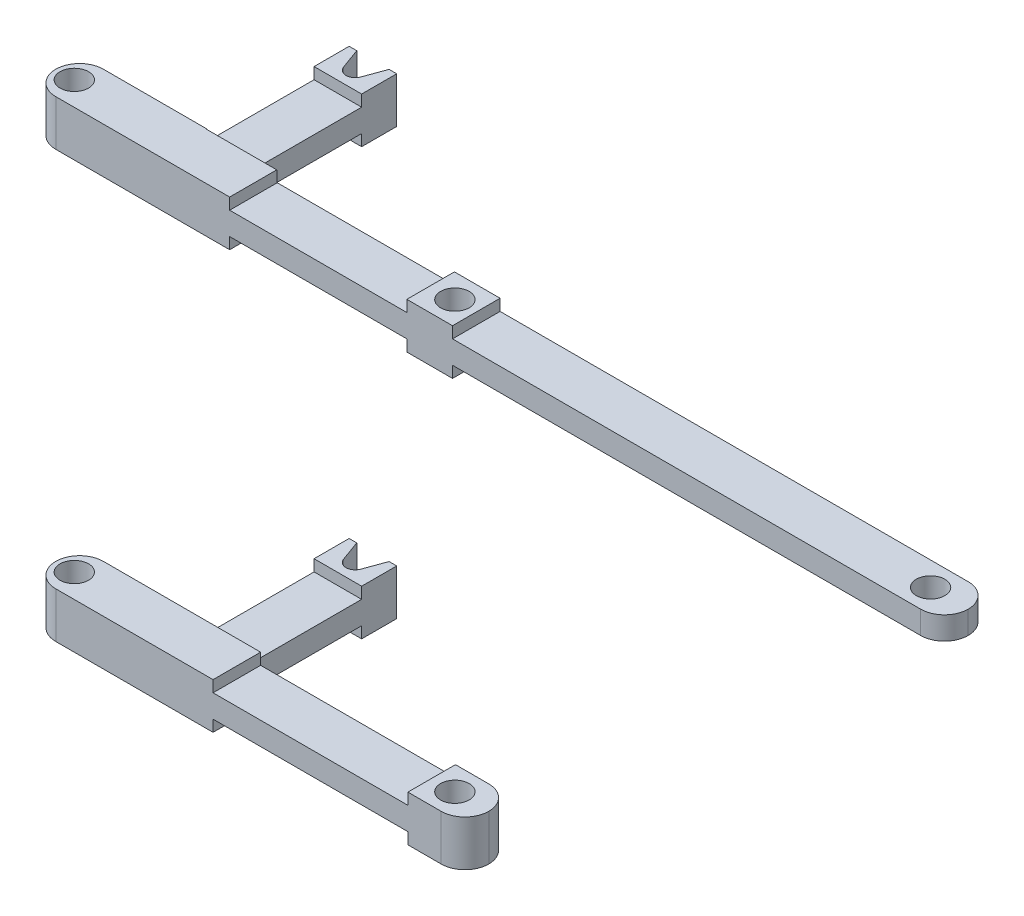
from build123d import *

# Parameters (mm, degrees)
SKETCH1_R                = 7.5
BOSS_EXTRUDE1_DEPTH      = 24
SKETCH7_R                = 7.5
BOSS_EXTRUDE2_DEPTH      = 24
SKETCH9_W                = 267.304996702
SKETCH9_H                = 6
SKETCH9_W_2              = 93.120375714
CUT_EXTRUDE2_DEPTH       = 25
SKETCH10_W               = 102.39026263
SKETCH10_H               = 6
CUT_EXTRUDE6_DEPTH       = 40
CUT_EXTRUDE7_START       = -37.208675348
CUT_EXTRUDE7_OUTLINE_W   = 56.567816269
CUT_EXTRUDE7_OUTLINE_H   = 6
CUT_EXTRUDE7_OUTLINE_W_2 = 56.815074254
CUT_EXTRUDE7_DEPTH       = 37.208675348
FILLET1_R                = 12.5
FILLET2_R                = 12.5


# Read off the part's stored shape, not the designer's step: Cut-Extrude7
with BuildPart() as part:
    # Sketch1 → Boss-Extrude1 (new body)
    with BuildSketch(Plane(origin=(0, 0, 0), x_dir=(1, 0, 0), z_dir=(0, 1, 0))):
        with BuildLine():
            Line((-206.314451257, 94.69754914), (-210.303240713, 105.656658099))
            Line((-210.303240713, 105.656658099), (-214.303240713, 105.656658099))
            Line((-214.303240713, 105.656658099), (-214.303240713, 30.656658099))
            Line((-214.303240713, 30.656658099), (-280.969907379, 30.656658099))
            Line((-280.969907379, 30.656658099), (-280.969907379, 5.656658099))
            Line((-280.969907379, 5.656658099), (198.538356926, 5.656658099))
            Line((198.538356926, 5.656658099), (198.538356926, 30.656658099))
            Line((198.538356926, 30.656658099), (-189.303240713, 30.656658099))
            Line((-189.303240713, 30.656658099), (-189.303240713, 105.656658099))
            Line((-189.303240713, 105.656658099), (-193.303240713, 105.656658099))
            Line((-193.303240713, 105.656658099), (-197.292030168, 94.69754914))
            ThreePointArc((-197.292030168, 94.69754914), (-201.803240713, 91.53876551), (-206.314451257, 94.69754914))
        make_face()
        with Locations(Location((-271.236698838, 18.156658099, 0), (0, 0, 270))):
            Circle(SKETCH1_R, mode=Mode.SUBTRACT)
        with BuildLine():
            ThreePointArc((-63.736698838, 18.156658099), (-71.236698838, 10.656658099), (-78.736698838, 18.156658099))
            ThreePointArc((-78.736698838, 18.156658099), (-71.236698838, 25.656658099), (-63.736698838, 18.156658099))
        make_face(mode=Mode.SUBTRACT)
        with Locations(Location((178.763301162, 18.156658099, 0), (0, 0, 270))):
            Circle(SKETCH1_R, mode=Mode.SUBTRACT)
    extrude(amount=BOSS_EXTRUDE1_DEPTH)

    # Sketch9 → Cut-Extrude2 (cut)
    with BuildSketch(Plane.XY.offset(-5.656658099)):
        with Locations((73.678308701, 21)):
            Rectangle(SKETCH9_W, SKETCH9_H)
        with Locations((73.678308701, 3)):
            Rectangle(SKETCH9_W, SKETCH9_H)
        with Locations((-130.534377507, 21)):
            Rectangle(SKETCH9_W_2, SKETCH9_H)
        with Locations((-130.534377507, 3)):
            Rectangle(SKETCH9_W_2, SKETCH9_H)
    extrude(amount=-CUT_EXTRUDE2_DEPTH, mode=Mode.SUBTRACT)


with BuildPart() as body_2:
    # Sketch7 → Boss-Extrude2 (new body)
    with BuildSketch(Plane(origin=(0, -200, 0), x_dir=(-1, 0, 0), z_dir=(0, -1, 0))):
        with BuildLine():
            Line((53.429067072, 30.656658099), (53.429067072, 5.656658099))
            Line((53.429067072, 5.656658099), (280.969907379, 5.656658099))
            Line((280.969907379, 5.656658099), (280.969907379, 30.656658099))
            Line((280.969907379, 30.656658099), (214.303240713, 30.656658099))
            Line((214.303240713, 30.656658099), (214.303240713, 105.656658099))
            Line((214.303240713, 105.656658099), (210.303240713, 105.656658099))
            Line((210.303240713, 105.656658099), (206.314451257, 94.69754914))
            ThreePointArc((206.314451257, 94.69754914), (201.803240713, 91.53876551), (197.292030168, 94.69754914))
            Line((197.292030168, 94.69754914), (193.303240713, 105.656658099))
            Line((193.303240713, 105.656658099), (189.303240713, 105.656658099))
            Line((189.303240713, 105.656658099), (189.303240713, 30.656658099))
            Line((189.303240713, 30.656658099), (53.429067072, 30.656658099))
        make_face()
        with Locations(Location((271.236698838, 18.156658099, 0), (0, 0, 90))):
            Circle(SKETCH7_R, mode=Mode.SUBTRACT)
        with Locations(Location((71.236698838, 18.156658099, 0), (0, 0, 90))):
            Circle(SKETCH7_R, mode=Mode.SUBTRACT)
    extrude(amount=BOSS_EXTRUDE2_DEPTH)

    # Sketch10 → Cut-Extrude6 (cut)
    with BuildSketch(Plane.XY.offset(-5.656658099)):
        with Locations((-134.624198387, -203)):
            Rectangle(SKETCH10_W, SKETCH10_H)
        with Locations((-134.624198387, -221)):
            Rectangle(SKETCH10_W, SKETCH10_H)
    extrude(amount=-CUT_EXTRUDE6_DEPTH, mode=Mode.SUBTRACT)


with BuildPart() as cut_extrude7_tool:
    # Cut-Extrude7 outline → Cut-Extrude7 (new body)
    with BuildSketch(Plane.ZY.offset(214.303240713).offset(CUT_EXTRUDE7_START)):
        with Locations((-58.940566234, -221)):
            Rectangle(CUT_EXTRUDE7_OUTLINE_W, CUT_EXTRUDE7_OUTLINE_H)
        with Locations((-58.940566234, -203)):
            Rectangle(CUT_EXTRUDE7_OUTLINE_W, CUT_EXTRUDE7_OUTLINE_H)
        with Locations((-58.816937241, 21)):
            Rectangle(CUT_EXTRUDE7_OUTLINE_W_2, CUT_EXTRUDE7_OUTLINE_H)
        with Locations((-58.816937241, 3)):
            Rectangle(CUT_EXTRUDE7_OUTLINE_W_2, CUT_EXTRUDE7_OUTLINE_H)
    extrude(amount=CUT_EXTRUDE7_DEPTH)


with BuildPart() as part_1:
    add(part.part)

    # Cut-Extrude7: cut by cut_extrude7_tool
    add(cut_extrude7_tool.part, mode=Mode.SUBTRACT)

    # Fillet1
    fillet1_edges = [part_1.edges().sort_by_distance(p)[0] for p in [
        (-280.969907379, 12, -5.656658099),
        (-280.969907379, 12, -30.656658099),
        (198.538356926, 12, -5.656658099),
        (198.538356926, 12, -30.656658099),
    ]]
    fillet(fillet1_edges, radius=FILLET1_R - 0.0001)  # a hair under: the kernel refuses the full size


with BuildPart() as body_2_1:
    add(body_2.part)

    # Cut-Extrude7: cut by cut_extrude7_tool
    add(cut_extrude7_tool.part, mode=Mode.SUBTRACT)

    # Fillet2
    fillet2_edges = [body_2_1.edges().sort_by_distance(p)[0] for p in [
        (-53.429067072, -212, -5.656658099),
        (-53.429067072, -212, -30.656658099),
        (-280.969907379, -212, -5.656658099),
        (-280.969907379, -212, -30.656658099),
    ]]
    fillet(fillet2_edges, radius=FILLET2_R - 0.0001)  # a hair under: the kernel refuses the full size


solid = Compound([part_1.part, body_2_1.part])
